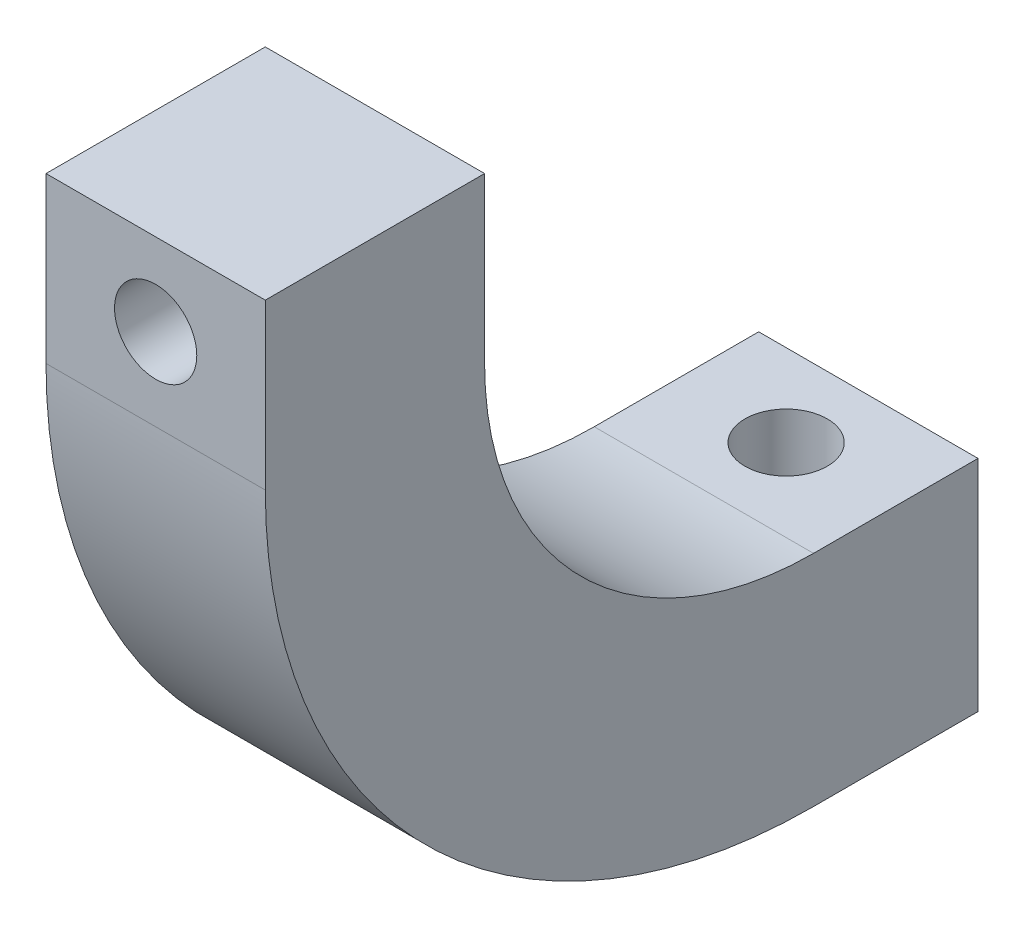
from build123d import *

# Parameters (mm, degrees)
BOSS_EXTRUDE1_DEPTH      = 4
BOSS_EXTRUDE1_DEPTH_BACK = 4
SKETCH7_R                = 1.5
CUT_EXTRUDE1_DEPTH       = 33.771939216
SKETCH8_R                = 1.5
CUT_EXTRUDE2_DEPTH       = 33.771939216


with BuildPart() as part:
    # Sketch5 → Boss-Extrude1 (new, two sides: drawn at the far end of the back side and taken through both)
    with BuildSketch(Plane(origin=(0, 0, 0), x_dir=(0, 0, -1), z_dir=(1, 0, 0)).offset(-BOSS_EXTRUDE1_DEPTH_BACK)):
        with BuildLine():
            Line((-15, 3), (-15, 0))
            Line((-15, 0), (-15, -3))
            ThreePointArc((-15, -3), (-11.485281374, -11.485281374), (-3, -15))
            Line((-3, -15), (0, -15))
            Line((0, -15), (3, -15))
            Line((3, -15), (3, -23))
            Line((3, -23), (-3, -23))
            ThreePointArc((-3, -23), (-17.142135624, -17.142135624), (-23, -3))
            Line((-23, -3), (-23, 3))
            Line((-23, 3), (-15, 3))
        make_face()
    extrude(amount=BOSS_EXTRUDE1_DEPTH + BOSS_EXTRUDE1_DEPTH_BACK)

    # Sketch7 → Cut-Extrude1 (cut, through all)
    with BuildSketch(Plane.XY):
        Circle(SKETCH7_R)
    extrude(amount=CUT_EXTRUDE1_DEPTH, mode=Mode.SUBTRACT)

    # Sketch8 → Cut-Extrude2 (cut, through all)
    with BuildSketch(Plane(origin=(0, 0, 0), x_dir=(1, 0, 0), z_dir=(0, 1, 0))):
        Circle(SKETCH8_R)
    extrude(amount=-CUT_EXTRUDE2_DEPTH, mode=Mode.SUBTRACT)


solid = part.part
